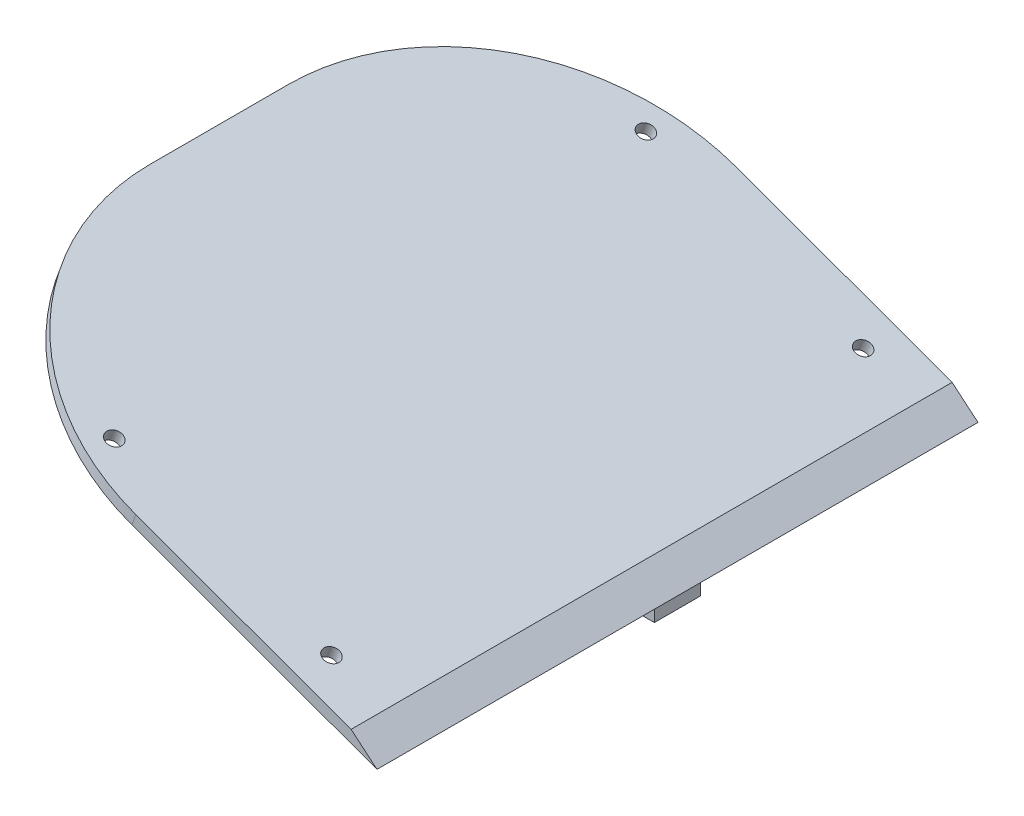
from build123d import *

# Parameters (mm, degrees)
ESTRUSIONE_ESTRUSIONE1_DEPTH      = 5
ESTRUSIONE_ESTRUSIONE1_DEPTH_BACK = 5
ESTRUSIONE_ESTRUSIONE3_DEPTH      = 5
FORO_PER_VITE_M3_1_D              = 3.4
SCHIZZO26_W                       = 106.417777248
SCHIZZO26_H                       = 130
ESTRUSIONE_ESTRUSIONE5_DEPTH      = 2.5
NERVATURA2_REACH                  = 94.596
SCHIZZO29_WALL_W                  = 248.530633184
SCHIZZO29_WALL_H                  = 10
SMUSSO1_SIZE2                     = 6.868693549
SMUSSO1_SIZE                      = 2.5
RACCORDO1_R                       = 50
FORO_PER_VITE_M3_2_D              = 3.4


with BuildPart() as part:
    # Schizzo1 → Estrusione-Estrusione1 (new, two sides: drawn at the far end of the back side and taken through both)
    with BuildSketch(Plane.XY.offset(-ESTRUSIONE_ESTRUSIONE1_DEPTH_BACK)):
        Polygon((0, 0), (-100, 0), (-100, 38.897023427), (0, 2.5), align=None)
    extrude(amount=ESTRUSIONE_ESTRUSIONE1_DEPTH + ESTRUSIONE_ESTRUSIONE1_DEPTH_BACK)

    # Schizzo18 → Estrusione-Estrusione3 (add)
    with BuildSketch(Plane.XZ):
        with BuildLine():
            Line((-87.5, 5), (-72.5, 5))
            ThreePointArc((-72.5, 5), (-80, 12.5), (-87.5, 5))
        make_face()
    estrusione_estrusione3 = extrude(amount=-ESTRUSIONE_ESTRUSIONE3_DEPTH)

    # Foro per Vite M3-1 (through all)
    with Locations(Plane(origin=(-80, 5, 8.5), x_dir=(1, 0, 0), z_dir=(0, 1, 0))):
        with Locations((0, 0)):
            foro_per_vite_m3_1 = Hole(FORO_PER_VITE_M3_1_D / 2)

    # Specchia2: Estrusione-Estrusione3, Foro per Vite M3-1 across plane
    add(estrusione_estrusione3.mirror(Plane.XY))
    add(foro_per_vite_m3_1.mirror(Plane.XY), mode=Mode.SUBTRACT)

    # Schizzo26 → Estrusione-Estrusione5 (add)
    with BuildSketch(Plane(origin=(0.803484512, 2.207555554, 0), x_dir=(0.9396926207859082, -0.3420201433256694, 0), z_dir=(0.3420201433256694, 0.9396926207859083, 0))):
        with Locations((-54.063938982, 0)):
            Rectangle(SCHIZZO26_W, SCHIZZO26_H)
    extrude(amount=ESTRUSIONE_ESTRUSIONE5_DEPTH)

    # Schizzo29 wall → Nervatura2 (add, up to next)
    with BuildSketch(Plane(origin=(-41.11120737, 10.684369938, 35), x_dir=(0.071039265759, 0.195178778583, 0.978191528849), z_dir=(-0.334561206897, -0.919199361374, 0.207704917825)), mode=Mode.PRIVATE) as nervatura2_sk1:
        Rectangle(SCHIZZO29_WALL_W, SCHIZZO29_WALL_H)
    nervatura2_tool1 = extrude(nervatura2_sk1.sketch, amount=-NERVATURA2_REACH, mode=Mode.PRIVATE) - part.part
    nervatura2 = nervatura2_tool1.solids().sort_by_distance((-41.11120737, 10.684369938, 35))[0]
    add(nervatura2)

    # Specchia3: Nervatura2 across plane
    add(nervatura2.mirror(Plane.XY))

    # Smusso1
    smusso1_edges = [part.edges().sort_by_distance(p)[0] for p in [
        (0.855050358, 4.849231552, 0),
    ]]
    smusso1_side = [part.faces().sort_by_distance(p)[0] for p in [
        (0.837949351, 4.802246921, 0),
    ]]
    chamfer(smusso1_edges, length=SMUSSO1_SIZE - 0.0001, length2=SMUSSO1_SIZE2 - 0.0001, reference=smusso1_side[0])  # a hair under: the kernel refuses the full size

    # Raccordo1
    raccordo1_edges = [part.edges().sort_by_distance(p)[0] for p in [
        (-99.572474821, 40.071639203, -65),
        (-99.572474821, 40.071639203, 65),
    ]]
    fillet(raccordo1_edges, radius=RACCORDO1_R)

    # Foro per Vite M3-2 (through all)
    with Locations(Plane(origin=(1.65853487, 4.556787106, 0), x_dir=(0.9396926207859082, -0.3420201433256695, 0), z_dir=(0.3420201433256695, 0.9396926207859082, 0))):
        with Locations((-70.223743907, 57.5), (-70.223743907, -57.5), (-20.223743907, -57.5), (-20.223743907, 57.5)):
            Hole(FORO_PER_VITE_M3_2_D / 2)


solid = part.part
